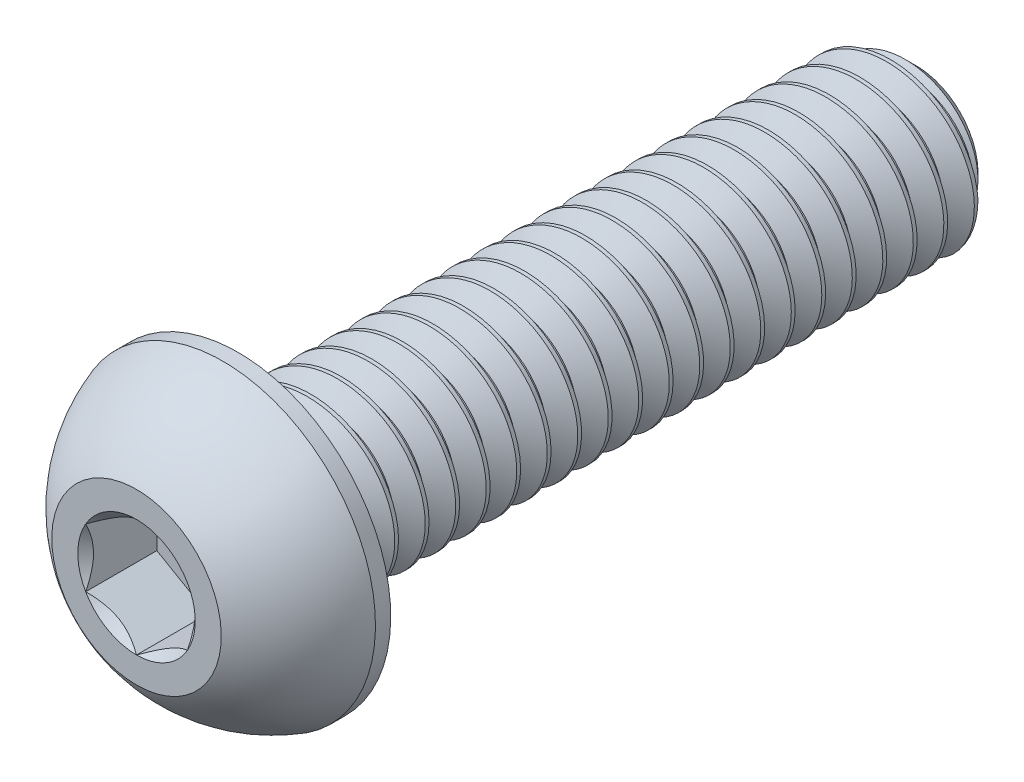
from build123d import *

# Parameters (mm, degrees)
CUT_EXTRUDE2_DEPTH = 1.05
CUT_SWEEP2_PITCH   = 0.45
CUT_SWEEP2_TO      = 10


with BuildPart() as part:
    # Sketch10 → Revolve3 (revolve)
    with BuildSketch(Plane(origin=(0, 0, 0), x_dir=(0, 0, -1), z_dir=(1, 0, 0)), mode=Mode.PRIVATE) as revolve3_sk:
        Polygon((4.6625, 1.25), (5, 0.9125), (5, 0), (-5, 0), (-5, 1.25), align=None)
    revolve(revolve3_sk.sketch.rotate(Axis((0, 0, 6.5), (0, 0, -1)), 180), axis=Axis((0, 0, 6.5), (0, 0, -1)))

    # Sketch7 → Revolve2 (revolve)
    with BuildSketch(Plane(origin=(0, 0, 0), x_dir=(0, 0, -1), z_dir=(1, 0, 0)), mode=Mode.PRIVATE) as revolve2_sk:
        with BuildLine():
            Line((-5.225, 2.25), (-5, 2.25))
            Line((-5, 2.25), (-5, 0))
            Line((-5, 0), (-6.5, 0))
            Line((-6.5, 0), (-6.5, 1.25))
            ThreePointArc((-6.5, 1.25), (-5.950735294, 1.8625), (-5.225, 2.25))
        make_face()
    revolve(revolve2_sk.sketch.rotate(Axis((0, 0, 6.5), (0, 0, -1)), 180), axis=Axis((0, 0, 6.5), (0, 0, -1)))

    # Sketch5 → Cut-Extrude2 (cut)
    with BuildSketch(Plane.XY.offset(6.5)):
        Polygon((0.75, -0.433012702), (0.75, 0.433012702), (0, 0.866025404), (-0.75, 0.433012702), (-0.75, -0.433012702), (0, -0.866025404), align=None)
    extrude(amount=-CUT_EXTRUDE2_DEPTH, mode=Mode.SUBTRACT)

    # Cut-Extrude3 cone 1 section (through the dimple's axis) → Cut-Extrude3 (revolve, cut)
    with BuildSketch(Plane(origin=(0, 0, 6.5), x_dir=(0, -1, 0), z_dir=(1, 0, 0))):
        Polygon((0, 0), (0.866025404, 0), (0, 0.866025404), align=None)
    revolve(axis=Axis((0, 0, 6.5), (0, 0, -1)), mode=Mode.SUBTRACT)


with BuildPart() as body_2:
    # Split1: read off the stored shape, not the designer's step
    # Split1: the piece on the far side of the plane
    add(part.part)
    split(bisect_by=Plane.XY.offset(5), keep=Keep.BOTTOM)

    # Cut-Sweep2: arcs per turn and ends read off the stored shape
    # Cut-Sweep2: the profile of Sketch12 screwed along a right-hand helix through 26.666667 turns, 6 arcs to a turn; built about Z, then put on its axis
    cut_sweep2_z = Axis((0, 0, 0), (0, 0, 1))
    cut_sweep2_corners = [(0.957716426, 0, -0.16875), (0.957716426, 0, -0.225), (1.274356964, 0, -0.4078125), (1.274356964, 0, 0.0140625)]
    with BuildLine(mode=Mode.PRIVATE) as cut_sweep2_profile:
        Line(cut_sweep2_corners[0], cut_sweep2_corners[1])
        Line(cut_sweep2_corners[1], cut_sweep2_corners[2])
        Line(cut_sweep2_corners[2], cut_sweep2_corners[3])
        Line(cut_sweep2_corners[3], cut_sweep2_corners[0])
    cut_sweep2_cap = Face(cut_sweep2_profile.wire())
    cut_sweep2_turn_angles = [0, 30, 60, 90, 120, 150, 180, 210, 240, 270, 300, 330, 360]
    cut_sweep2_turn_weights = [1, 0.8660254037844387, 1, 0.8660254037844387, 1, 0.8660254037844387, 1, 0.8660254037844387, 1, 0.8660254037844387, 1, 0.8660254037844387, 1]
    cut_sweep2_turn_rails = [Edge.make_bspline([Vector(p[0], p[1], 0).rotate(cut_sweep2_z, cut_sweep2_turn_angles[k]) / cut_sweep2_turn_weights[k] + Vector(0, 0, p[2] + CUT_SWEEP2_PITCH * cut_sweep2_turn_angles[k] / 360) for k in range(13)], [0, 0, 0, 1, 1, 2, 2, 3, 3, 4, 4, 5, 5, 6, 6, 6], 2, cut_sweep2_turn_weights) for p in cut_sweep2_corners]
    cut_sweep2_turn_sides = [Face.make_surface_from_curves(cut_sweep2_turn_rails[p[0]], cut_sweep2_turn_rails[p[1]]) for p in [(0, 1), (1, 2), (2, 3), (3, 0)]]
    cut_sweep2_last_angles = [9360, 9390, 9420, 9450, 9480, 9510, 9540, 9570, 9600]
    cut_sweep2_last_weights = [1, 0.8660254037844387, 1, 0.8660254037844387, 1, 0.8660254037844387, 1, 0.8660254037844387, 1]
    cut_sweep2_last_rails = [Edge.make_bspline([Vector(p[0], p[1], 0).rotate(cut_sweep2_z, cut_sweep2_last_angles[k]) / cut_sweep2_last_weights[k] + Vector(0, 0, p[2] + CUT_SWEEP2_PITCH * cut_sweep2_last_angles[k] / 360) for k in range(9)], [0, 0, 0, 1, 1, 2, 2, 3, 3, 4, 4, 4], 2, cut_sweep2_last_weights) for p in cut_sweep2_corners]
    cut_sweep2_last_sides = [Face.make_surface_from_curves(cut_sweep2_last_rails[p[0]], cut_sweep2_last_rails[p[1]]) for p in [(0, 1), (1, 2), (2, 3), (3, 0)]]
    cut_sweep2 = Plane(origin=(0, 0, -5), x_dir=(0, 1, 0), z_dir=(0, 0, 1)) * split(Solid(Shell([*[p.moved(Location((0, 0, CUT_SWEEP2_PITCH * i))) for i in range(26) for p in cut_sweep2_turn_sides], *cut_sweep2_last_sides, cut_sweep2_cap, cut_sweep2_cap.rotate(cut_sweep2_z, 9600).moved(Location((0, 0, CUT_SWEEP2_PITCH * 9600 / 360)))])), bisect_by=Plane.XY.offset(CUT_SWEEP2_TO), keep=Keep.BOTTOM, mode=Mode.PRIVATE)
    add(cut_sweep2, mode=Mode.SUBTRACT)


with BuildPart() as part_1:
    add(part.part)

    # Split1
    split(bisect_by=Plane.XY.offset(5), keep=Keep.TOP)

    add(body_2.part)  # Boss-Extrude1 merges body 2
    # Boss-Extrude1 cone 1 section (through the dimple's axis) → Boss-Extrude1 (revolve)
    with BuildSketch(Plane(origin=(0, 0, 5), x_dir=(0, -1, 0), z_dir=(1, 0, 0))):
        Polygon((0, 0), (1.25, 0), (0, 1.25), align=None)
    revolve(axis=Axis((0, 0, 5), (0, 0, -1)))


solid = part_1.part
